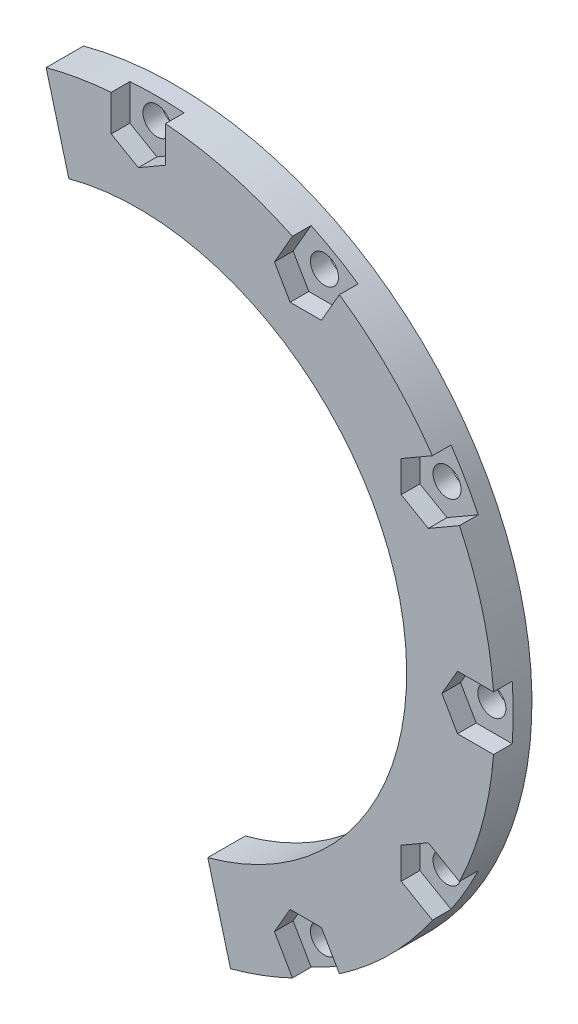
from build123d import *

# Parameters (mm, degrees)
SKETCH1_R           = 38.1
SKETCH1_R_2         = 28.702
BOSS_EXTRUDE1_DEPTH = 4
SKETCH2_R           = 1.5
CUT_EXTRUDE1_DEPTH  = 55.029806589
CUT_EXTRUDE2_DEPTH  = 2
CUT_EXTRUDE4_DEPTH  = 55.029806589


with BuildPart() as part:
    # Sketch1 → Boss-Extrude1 (new body)
    with BuildSketch(Plane.XY):
        Circle(SKETCH1_R)
        Circle(SKETCH1_R_2, mode=Mode.SUBTRACT)
    extrude(amount=BOSS_EXTRUDE1_DEPTH)

    # Sketch2 → Cut-Extrude1 (cut, through all)
    with BuildSketch(Plane.XY.offset(4)):
        with Locations((0, 35.814)):
            Circle(SKETCH2_R)
        with Locations((17.907, 31.015833811)):
            Circle(SKETCH2_R)
        with Locations((31.015833811, 17.907)):
            Circle(SKETCH2_R)
        with Locations((35.814, 0)):
            Circle(SKETCH2_R)
        with Locations((31.015833811, -17.907)):
            Circle(SKETCH2_R)
        with Locations((17.907, -31.015833811)):
            Circle(SKETCH2_R)
        with Locations((0, -35.814)):
            Circle(SKETCH2_R)
        with Locations((-17.907, -31.015833811)):
            Circle(SKETCH2_R)
        with Locations((-31.015833811, -17.907)):
            Circle(SKETCH2_R)
        with Locations((-35.814, 0)):
            Circle(SKETCH2_R)
        with Locations((-31.015833811, 17.907)):
            Circle(SKETCH2_R)
        with Locations((-17.907, 31.015833811)):
            Circle(SKETCH2_R)
    extrude(amount=-CUT_EXTRUDE1_DEPTH, mode=Mode.SUBTRACT)

    # Sketch3 → Cut-Extrude2 (cut)
    with BuildSketch(Plane.XY.offset(4)):
        Polygon((-2.9, 37.989472226), (0, 39.162631561), (2.9, 37.989472226), (2.9, 34.139684219), (0, 32.465368439), (-2.9, 34.139684219), align=None)
        Polygon((16.483262442, 34.349848024), (19.581315781, 33.915833811), (21.506209784, 31.449848024), (19.581315781, 28.115833811), (16.232684219, 28.115833811), (14.558368439, 31.015833811), align=None)
        Polygon((31.449848024, 21.506209784), (33.915833811, 19.581315781), (34.349848024, 16.483262442), (31.015833811, 14.558368439), (28.115833811, 16.232684219), (28.115833811, 19.581315781), align=None)
        Polygon((37.989472226, 2.9), (39.162631561, 0), (37.989472226, -2.9), (34.139684219, -2.9), (32.465368439, 0), (34.139684219, 2.9), align=None)
        Polygon((34.349848024, -16.483262442), (33.915833811, -19.581315781), (31.449848024, -21.506209784), (28.115833811, -19.581315781), (28.115833811, -16.232684219), (31.015833811, -14.558368439), align=None)
        Polygon((21.506209784, -31.449848024), (19.581315781, -33.915833811), (16.483262442, -34.349848024), (14.558368439, -31.015833811), (16.232684219, -28.115833811), (19.581315781, -28.115833811), align=None)
        Polygon((2.9, -37.989472226), (0, -39.162631561), (-2.9, -37.989472226), (-2.9, -34.139684219), (0, -32.465368439), (2.9, -34.139684219), align=None)
        Polygon((-16.483262442, -34.349848024), (-19.581315781, -33.915833811), (-21.506209784, -31.449848024), (-19.581315781, -28.115833811), (-16.232684219, -28.115833811), (-14.558368439, -31.015833811), align=None)
        Polygon((-31.449848024, -21.506209784), (-33.915833811, -19.581315781), (-34.349848024, -16.483262442), (-31.015833811, -14.558368439), (-28.115833811, -16.232684219), (-28.115833811, -19.581315781), align=None)
        Polygon((-37.989472226, -2.9), (-39.162631561, 0), (-37.989472226, 2.9), (-34.139684219, 2.9), (-32.465368439, 0), (-34.139684219, -2.9), align=None)
        Polygon((-34.349848024, 16.483262442), (-33.915833811, 19.581315781), (-31.449848024, 21.506209784), (-28.115833811, 19.581315781), (-28.115833811, 16.232684219), (-31.015833811, 14.558368439), align=None)
        Polygon((-21.506209784, 31.449848024), (-19.581315781, 33.915833811), (-16.483262442, 34.349848024), (-14.558368439, 31.015833811), (-16.232684219, 28.115833811), (-19.581315781, 28.115833811), align=None)
    extrude(amount=-CUT_EXTRUDE2_DEPTH, mode=Mode.SUBTRACT)

    # Sketch5 → Cut-Extrude4 (cut, through all)
    with BuildSketch(Plane.XY.offset(4)):
        with BuildLine():
            Line((9.861005618, -36.801773982), (-9.861005618, 36.801773982))
            ThreePointArc((-9.861005618, 36.801773982), (-36.801773982, -9.861005618), (9.861005618, -36.801773982))
        make_face()
    extrude(amount=-CUT_EXTRUDE4_DEPTH, mode=Mode.SUBTRACT)


solid = part.part
